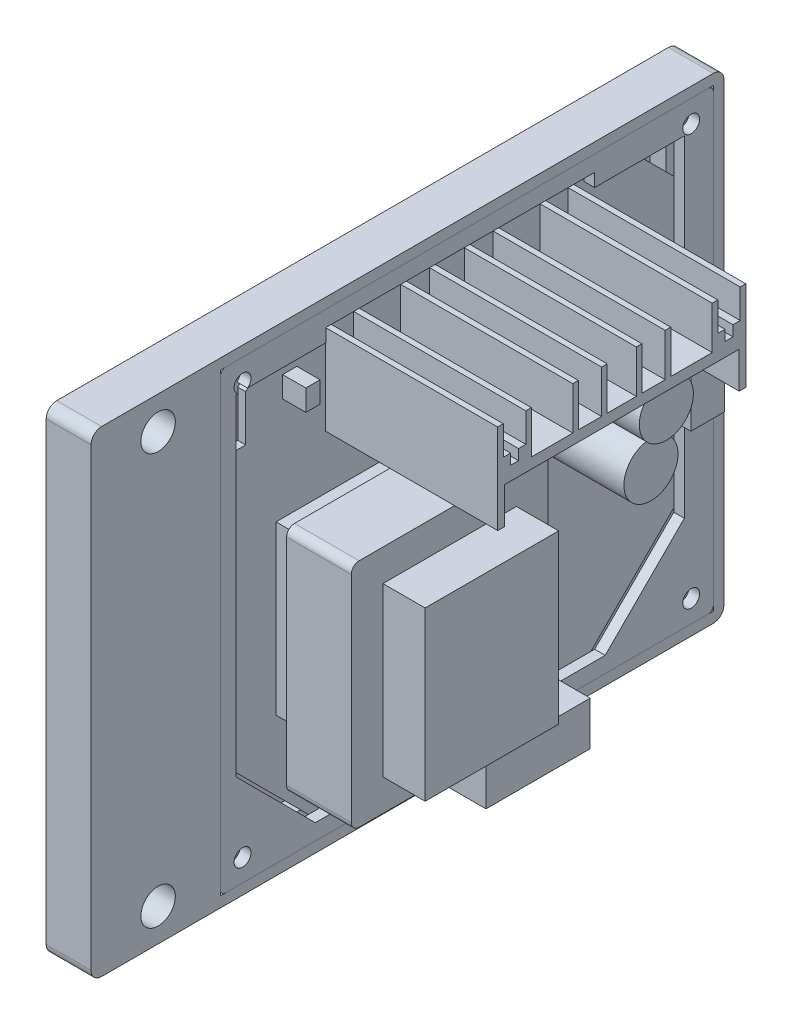
from build123d import *

# Parameters (mm, degrees)
CUT_EXTRUDE1_START       = -1.5
CUT_EXTRUDE1_OUTLINE_W   = 25.3
CUT_EXTRUDE1_OUTLINE_H   = 31.72
CUT_EXTRUDE1_DEPTH       = 29.75
CUT_EXTRUDE1_START_2     = 8
CUT_EXTRUDE1_2_OUTLINE_W = 25.3
CUT_EXTRUDE1_2_OUTLINE_H = 31.72
CUT_EXTRUDE1_2_OUTLINE_R = 5.125
CUT_EXTRUDE1_2_DEPTH     = 12.25
CUT_EXTRUDE1_3_OUTLINE_W = 25.3
CUT_EXTRUDE1_3_OUTLINE_H = 31.72
CUT_EXTRUDE1_3_DEPTH     = 1.5
CUT_EXTRUDE1_4_OUTLINE_R = 5.125
CUT_EXTRUDE1_4_OUTLINE_W = 19.75
CUT_EXTRUDE1_4_OUTLINE_H = 8.3
CUT_EXTRUDE1_4_DEPTH     = 16.14
CUT_EXTRUDE1_5_OUTLINE_W = 6.35
CUT_EXTRUDE1_5_OUTLINE_H = 12.7
CUT_EXTRUDE1_5_DEPTH     = 9
CUT_EXTRUDE1_START_3     = 28.25
CUT_EXTRUDE1_6_DEPTH     = 1.75
CUT_EXTRUDE1_7_OUTLINE_W = 7.2
CUT_EXTRUDE1_7_OUTLINE_H = 7.2
CUT_EXTRUDE1_7_DEPTH     = 4.5
CUT_EXTRUDE1_START_4     = 16.14
CUT_EXTRUDE1_8_OUTLINE_W = 19.75
CUT_EXTRUDE1_8_OUTLINE_H = 8.3
CUT_EXTRUDE1_8_DEPTH     = 0.61
CUT_EXTRUDE1_START_5     = 20.25
CUT_EXTRUDE1_9_OUTLINE_R = 5.125
CUT_EXTRUDE1_9_DEPTH     = 0.39
SKETCH2_W                = 2.7
SKETCH2_H                = 4
BOSS_EXTRUDE2_DEPTH      = 4.4
SKETCH3_R                = 0.5
BOSS_EXTRUDE3_DEPTH      = 3
MOVE_FACE1_BY            = 2.6
MOVE_START               = 13.65
MOVE_FACE2_OUTLINE_R     = 5.125
MOVE_FACE2_DEPTH         = 0.36
SKETCH4_W                = 93.4
SKETCH4_H                = 86.25
SKETCH4_R                = 1.25
BOSS_EXTRUDE4_DEPTH      = 3
BOSS_EXTRUDE5_START      = 3
SKETCH4_3_W              = 93.4
SKETCH4_3_H              = 86.25
SKETCH4_3_R              = 1.6
BOSS_EXTRUDE5_DEPTH      = 2
BOSS_EXTRUDE6_START      = -1.5
SKETCH4_4_W              = 93.4
SKETCH4_4_H              = 86.25
SKETCH4_4_R              = 1.6
BOSS_EXTRUDE6_DEPTH      = 2
BOSS_EXTRUDE7_START      = -3.5
SKETCH4_5_W              = 93.4
SKETCH4_5_H              = 86.25
SKETCH4_5_R              = 3.2639
BOSS_EXTRUDE7_DEPTH      = 8.5
FILLET1_R                = 1
FILLET2_R                = 2


with BuildPart() as part:
    # Cut-Extrude1: read off the stored shape, not the designer's step
    # Cut-Extrude1 outline → Cut-Extrude1 (new body)
    with BuildSketch(Plane(origin=(-2.49, 0, 0), x_dir=(0, 0, -1), z_dir=(1, 0, 0)).offset(CUT_EXTRUDE1_START)):
        with Locations((-263.102543264, -6.78)):
            Rectangle(CUT_EXTRUDE1_OUTLINE_W, CUT_EXTRUDE1_OUTLINE_H)
        Polygon((-240.09, 28.14), (-245.61, 28.14), (-245.61, 36.25), (-246.67, 36.25), (-246.67, 28.14), (-251.07, 28.14), (-251.07, 36.25), (-252.13, 36.25), (-252.13, 28.14), (-259.98, 28.14), (-259.98, 36.25), (-261.04, 36.25), (-261.04, 30.75), (-262.415, 30.75), (-262.415, 28.75), (-263.915, 28.75), (-263.915, 30.75), (-265.29, 30.75), (-265.29, 36.25), (-266.35, 36.25), (-266.35, 19.25), (-265.1, 19.25), (-265.1, 26.14), (-220.6, 26.14), (-220.6, 19.25), (-219.35, 19.25), (-219.35, 36.25), (-220.41, 36.25), (-220.41, 30.75), (-221.785, 30.75), (-221.785, 28.75), (-223.285, 28.75), (-223.285, 30.75), (-224.66, 30.75), (-224.66, 36.25), (-225.72, 36.25), (-225.72, 28.14), (-233.57, 28.14), (-233.57, 36.25), (-234.63, 36.25), (-234.63, 28.14), (-239.03, 28.14), (-239.03, 36.25), (-240.09, 36.25), align=None)
    extrude(amount=CUT_EXTRUDE1_DEPTH)

    # Cut-Extrude1 2 outline → Cut-Extrude1 2 (add)
    # profile 1 of 2: a face of its own
    with BuildSketch(Plane(origin=(-2.49, 0, 0), x_dir=(0, 0, -1), z_dir=(1, 0, 0)).offset(CUT_EXTRUDE1_START_2)):
        with BuildLine():
            ThreePointArc((-280.252543264, 15.08), (-281.313203436, 14.640660172), (-281.752543264, 13.58))
            Line((-281.752543264, 13.58), (-281.752543264, -27.14))
            ThreePointArc((-281.752543264, -27.14), (-281.313203436, -28.200660172), (-280.252543264, -28.64))
            Line((-280.252543264, -28.64), (-245.952543264, -28.64))
            ThreePointArc((-245.952543264, -28.64), (-244.891883092, -28.200660172), (-244.452543264, -27.14))
            Line((-244.452543264, -27.14), (-244.452543264, 13.58))
            ThreePointArc((-244.452543264, 13.58), (-244.891883092, 14.640660172), (-245.952543264, 15.08))
            Line((-245.952543264, 15.08), (-280.252543264, 15.08))
        make_face()
        with Locations((-263.102543264, -6.78)):
            Rectangle(CUT_EXTRUDE1_2_OUTLINE_W, CUT_EXTRUDE1_2_OUTLINE_H, mode=Mode.SUBTRACT)
    # profile 2 of 2: a face of its own
    with BuildSketch(Plane(origin=(-2.49, 0, 0), x_dir=(0, 0, -1), z_dir=(1, 0, 0)).offset(CUT_EXTRUDE1_START_2)):
        with Locations((-222.447456736, 11.25)):
            Circle(CUT_EXTRUDE1_2_OUTLINE_R)
    extrude(amount=CUT_EXTRUDE1_2_DEPTH)

    # Cut-Extrude1 3 outline → Cut-Extrude1 3 (add)
    with BuildSketch(Plane(origin=(-2.49, 0, 0), x_dir=(0, 0, -1), z_dir=(1, 0, 0)).offset(CUT_EXTRUDE1_START)):
        Polygon((-229.2, -44), (-218.1, -44), (-198.4, -24.3), (-198.4, 26.105086528), (-210.044913472, 37.75), (-277.083125881, 37.75), (-281.502543264, 33.330582618), (-281.502543264, 24.580582618), (-287.3, 24.580582618), (-287.3, -24.3), (-267.6, -44), (-256.5, -44), (-256.5, -42.3), (-251.4, -42.3), (-251.4, -44), (-234.3, -44), (-234.3, -42.3), (-229.2, -42.3), align=None)
        Polygon((-245.61, 36.25), (-245.61, 28.14), (-240.09, 28.14), (-240.09, 36.25), (-239.03, 36.25), (-239.03, 28.14), (-234.63, 28.14), (-234.63, 36.25), (-233.57, 36.25), (-233.57, 28.14), (-225.72, 28.14), (-225.72, 36.25), (-224.66, 36.25), (-224.66, 30.75), (-223.285, 30.75), (-223.285, 28.75), (-221.785, 28.75), (-221.785, 30.75), (-220.41, 30.75), (-220.41, 36.25), (-219.35, 36.25), (-219.35, 19.25), (-220.6, 19.25), (-220.6, 26.14), (-265.1, 26.14), (-265.1, 19.25), (-266.35, 19.25), (-266.35, 36.25), (-265.29, 36.25), (-265.29, 30.75), (-263.915, 30.75), (-263.915, 28.75), (-262.415, 28.75), (-262.415, 30.75), (-261.04, 30.75), (-261.04, 36.25), (-259.98, 36.25), (-259.98, 28.14), (-252.13, 28.14), (-252.13, 36.25), (-251.07, 36.25), (-251.07, 28.14), (-246.67, 28.14), (-246.67, 36.25), align=None, mode=Mode.SUBTRACT)
        with Locations((-263.102543264, -6.78)):
            Rectangle(CUT_EXTRUDE1_3_OUTLINE_W, CUT_EXTRUDE1_3_OUTLINE_H, mode=Mode.SUBTRACT)
    extrude(amount=CUT_EXTRUDE1_3_DEPTH)

    # Cut-Extrude1 4 outline → Cut-Extrude1 4 (add)
    with BuildSketch(Plane(origin=(-2.49, 0, 0), x_dir=(0, 0, -1), z_dir=(1, 0, 0))):
        with Locations((-221.216821393, -1.35)):
            Circle(CUT_EXTRUDE1_4_OUTLINE_R)
        with Locations((-242.85, -37)):
            Rectangle(CUT_EXTRUDE1_4_OUTLINE_W, CUT_EXTRUDE1_4_OUTLINE_H)
        with Locations((-222.447456736, 11.25)):
            Circle(CUT_EXTRUDE1_4_OUTLINE_R)
    extrude(amount=CUT_EXTRUDE1_4_DEPTH)

    # Cut-Extrude1 5 outline → Cut-Extrude1 5 (add)
    with BuildSketch(Plane(origin=(-2.49, 0, 0), x_dir=(0, 0, -1), z_dir=(1, 0, 0))):
        with Locations((-202.972456736, 0)):
            Rectangle(CUT_EXTRUDE1_5_OUTLINE_W, CUT_EXTRUDE1_5_OUTLINE_H)
    extrude(amount=CUT_EXTRUDE1_5_DEPTH)

    # Cut-Extrude1 6 outline → Cut-Extrude1 6 (add)
    with BuildSketch(Plane(origin=(-2.49, 0, 0), x_dir=(0, 0, -1), z_dir=(1, 0, 0)).offset(CUT_EXTRUDE1_START_3)):
        Polygon((-240.09, 28.14), (-245.61, 28.14), (-245.61, 36.25), (-246.67, 36.25), (-246.67, 28.14), (-251.07, 28.14), (-251.07, 36.25), (-252.13, 36.25), (-252.13, 28.14), (-259.98, 28.14), (-259.98, 36.25), (-261.04, 36.25), (-261.04, 30.75), (-262.415, 30.75), (-262.415, 28.75), (-263.915, 28.75), (-263.915, 30.75), (-265.29, 30.75), (-265.29, 36.25), (-266.35, 36.25), (-266.35, 19.25), (-265.1, 19.25), (-265.1, 26.14), (-220.6, 26.14), (-220.6, 19.25), (-219.35, 19.25), (-219.35, 36.25), (-220.41, 36.25), (-220.41, 30.75), (-221.785, 30.75), (-221.785, 28.75), (-223.285, 28.75), (-223.285, 30.75), (-224.66, 30.75), (-224.66, 36.25), (-225.72, 36.25), (-225.72, 28.14), (-233.57, 28.14), (-233.57, 36.25), (-234.63, 36.25), (-234.63, 28.14), (-239.03, 28.14), (-239.03, 36.25), (-240.09, 36.25), align=None)
    extrude(amount=CUT_EXTRUDE1_6_DEPTH)

    # Cut-Extrude1 7 outline → Cut-Extrude1 7 (add)
    with BuildSketch(Plane(origin=(-2.49, 0, 0), x_dir=(0, 0, -1), z_dir=(1, 0, 0))):
        with Locations((-232.947456736, -6)):
            Rectangle(CUT_EXTRUDE1_7_OUTLINE_W, CUT_EXTRUDE1_7_OUTLINE_H)
    extrude(amount=CUT_EXTRUDE1_7_DEPTH)

    # Cut-Extrude1 8 outline → Cut-Extrude1 8 (add)
    with BuildSketch(Plane(origin=(-2.49, 0, 0), x_dir=(0, 0, -1), z_dir=(1, 0, 0)).offset(CUT_EXTRUDE1_START_4)):
        with Locations((-242.85, -37)):
            Rectangle(CUT_EXTRUDE1_8_OUTLINE_W, CUT_EXTRUDE1_8_OUTLINE_H)
    extrude(amount=CUT_EXTRUDE1_8_DEPTH)

    # Cut-Extrude1 9 outline → Cut-Extrude1 9 (add)
    with BuildSketch(Plane(origin=(-2.49, 0, 0), x_dir=(0, 0, -1), z_dir=(1, 0, 0)).offset(CUT_EXTRUDE1_START_5)):
        with Locations((-222.447456736, 11.25)):
            Circle(CUT_EXTRUDE1_9_OUTLINE_R)
    extrude(amount=CUT_EXTRUDE1_9_DEPTH)

    # Sketch2 → Boss-Extrude2 (add)
    with BuildSketch(Plane(origin=(-2.49, 0, 0), x_dir=(0, 0, -1), z_dir=(1, 0, 0))):
        with Locations((-273.15, 30.62)):
            Rectangle(SKETCH2_W, SKETCH2_H)
    extrude(amount=BOSS_EXTRUDE2_DEPTH)

    # Sketch3 → Boss-Extrude3 (add)
    with BuildSketch(Plane.ZY.offset(2.49)):
        with Locations((234.85, -37.3)):
            Circle(SKETCH3_R)
        with Locations((250.85, -37.3)):
            Circle(SKETCH3_R)
    extrude(amount=BOSS_EXTRUDE3_DEPTH)

    # Move Face1: a face moved outward by 2.6
    extrude(part.faces().sort_by_distance((27.51, 27.75, 242.85))[0], amount=MOVE_FACE1_BY, dir=(1, 0, 0))

    # Move Face2: read off the stored shape, not the designer's step
    # Move Face2 outline → Move Face2 (add)
    with BuildSketch(Plane.YZ.offset(MOVE_START)):
        with Locations((-1.35, 221.216821393)):
            Circle(MOVE_FACE2_OUTLINE_R)
    extrude(amount=MOVE_FACE2_DEPTH)


with BuildPart() as body_2:
    # Sketch4 → Boss-Extrude4 (new body)
    with BuildSketch(Plane.ZY.offset(3.99)):
        with Locations((241.6, -1.875)):
            Rectangle(SKETCH4_W, SKETCH4_H)
        with Locations((284.1, -40.8)):
            Circle(SKETCH4_R, mode=Mode.SUBTRACT)
        with Locations((199.1, -40.8)):
            Circle(SKETCH4_R, mode=Mode.SUBTRACT)
        with Locations((199.1, 37.05)):
            Circle(SKETCH4_R, mode=Mode.SUBTRACT)
        with Locations((284.1, 37.05)):
            Circle(SKETCH4_R, mode=Mode.SUBTRACT)
        Polygon((285.3, 35.75), (285.3, -27.007106781), (270.307106781, -42), (215.392893219, -42), (200.4, -27.007106781), (200.4, -10.007106781), (197.9, -10.007106781), (197.9, 8.75), (200.4, 8.75), (200.4, 35.75), (217.4, 35.75), (217.4, 38.25), (268.3, 38.25), (268.3, 35.75), align=None, mode=Mode.SUBTRACT)
    extrude(amount=BOSS_EXTRUDE4_DEPTH)

    # Sketch4<3> → Boss-Extrude5 (add)
    with BuildSketch(Plane.ZY.offset(3.99).offset(BOSS_EXTRUDE5_START)):
        with Locations((241.6, -1.875)):
            Rectangle(SKETCH4_3_W, SKETCH4_3_H)
        with Locations((284.1, -40.8)):
            Circle(SKETCH4_3_R, mode=Mode.SUBTRACT)
        with Locations((199.1, -40.8)):
            Circle(SKETCH4_3_R, mode=Mode.SUBTRACT)
        with Locations((199.1, 37.05)):
            Circle(SKETCH4_3_R, mode=Mode.SUBTRACT)
        with Locations(Location((284.1, 37.05, 0), (0, 0, 234.340912304))):
            Circle(SKETCH4_3_R, mode=Mode.SUBTRACT)
    extrude(amount=BOSS_EXTRUDE5_DEPTH)

    # Sketch4<5> → Boss-Extrude7 (add)
    with BuildSketch(Plane.ZY.offset(3.99).offset(BOSS_EXTRUDE7_START)):
        Polygon((192.9, -47), (288.3, -47), (312.8, -47), (312.8, 43.25), (192.9, 43.25), align=None)
        with Locations((241.6, -1.875)):
            Rectangle(SKETCH4_5_W, SKETCH4_5_H, mode=Mode.SUBTRACT)
        with Locations(Location((300.1, 37.05, 0), (0, 0, 180))):
            Circle(SKETCH4_5_R, mode=Mode.SUBTRACT)
        with Locations(Location((300.1, -40.8, 0), (0, 0, 180))):
            Circle(SKETCH4_5_R, mode=Mode.SUBTRACT)
    extrude(amount=BOSS_EXTRUDE7_DEPTH)

    # Fillet2
    fillet2_edges = [body_2.edges().sort_by_distance(p)[0] for p in [
        (-4.74, -47, 192.9),
        (-4.74, -47, 312.8),
        (-4.74, 43.25, 312.8),
        (-4.74, 43.25, 192.9),
    ]]
    fillet(fillet2_edges, radius=FILLET2_R)


with BuildPart() as body_3:
    # Sketch4<4> → Boss-Extrude6 (new body)
    with BuildSketch(Plane.ZY.offset(3.99).offset(BOSS_EXTRUDE6_START)):
        with Locations((241.6, -1.875)):
            Rectangle(SKETCH4_4_W, SKETCH4_4_H)
        with Locations((199.1, -40.8)):
            Circle(SKETCH4_4_R, mode=Mode.SUBTRACT)
        with Locations((284.1, -40.8)):
            Circle(SKETCH4_4_R, mode=Mode.SUBTRACT)
        with BuildLine():
            Line((285.032737905, 35.75), (285.3, 35.75))
            Line((285.3, 35.75), (285.3, -27.007106781))
            Line((285.3, -27.007106781), (270.307106781, -42))
            Line((270.307106781, -42), (215.392893219, -42))
            Line((215.392893219, -42), (200.4, -27.007106781))
            Line((200.4, -27.007106781), (200.4, -10.007106781))
            Line((200.4, -10.007106781), (197.9, -10.007106781))
            Line((197.9, -10.007106781), (197.9, 8.75))
            Line((197.9, 8.75), (200.4, 8.75))
            Line((200.4, 8.75), (200.4, 28.812193309))
            Line((200.4, 28.812193309), (200.4, 35.75))
            Line((200.4, 35.75), (207.337806691, 35.75))
            Line((207.337806691, 35.75), (217.4, 35.75))
            Line((217.4, 35.75), (217.4, 38.25))
            Line((217.4, 38.25), (268.3, 38.25))
            Line((268.3, 38.25), (268.3, 35.75))
            Line((268.3, 35.75), (283.167262095, 35.75))
            ThreePointArc((283.167262095, 35.75), (283.3693772, 38.473443123), (285.7, 37.05))
            ThreePointArc((285.7, 37.05), (285.523443123, 36.3193772), (285.032737905, 35.75))
        make_face(mode=Mode.SUBTRACT)
        with Locations((199.1, 37.05)):
            Circle(SKETCH4_4_R, mode=Mode.SUBTRACT)
    extrude(amount=-BOSS_EXTRUDE6_DEPTH)

    # Fillet1
    fillet1_edges = [body_3.edges().sort_by_distance(p)[0] for p in [
        (-1.49, 41.25, 288.3),
        (-1.49, 41.25, 194.9),
        (-1.49, -45, 194.9),
        (-1.49, -45, 288.3),
    ]]
    fillet(fillet1_edges, radius=FILLET1_R)


solid = Compound([part.part, body_2.part, body_3.part])
